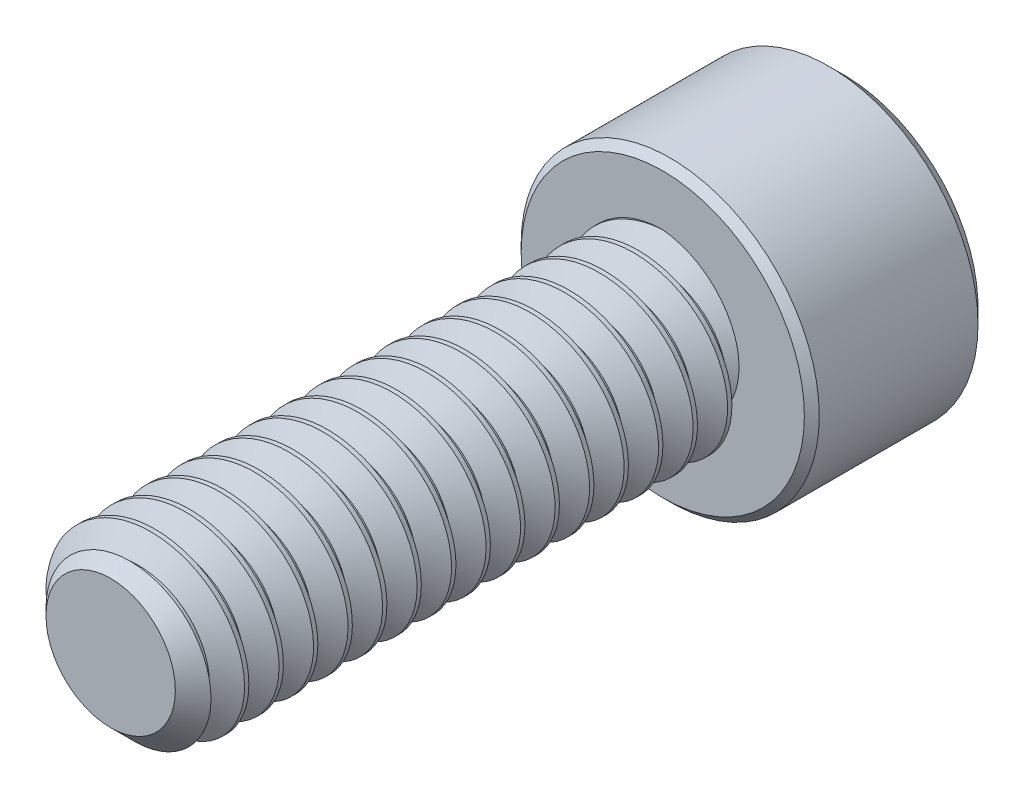
from build123d import *

# Parameters (mm, degrees)
SKETCH1_R          = 2.0828
EXTRUDE1_DEPTH     = 12.7
CHAMFER3_SIZE      = 0.5953125
CUT_SWEEP1_PITCH   = 0.79375
SKETCH6_R          = 3.429
EXTRUDE2_DEPTH     = 4.1656
CUT_EXTRUDE1_DEPTH = 2.67890625
CHAMFER1_SIZE      = 0.3429
CHAMFER2_SIZE      = 0.17145


with BuildPart() as part:
    # Sketch1 → Extrude1 (new body)
    with BuildSketch(Plane.XY):
        Circle(SKETCH1_R)
    extrude(amount=-EXTRUDE1_DEPTH)

    # Chamfer3
    chamfer3_edges = [part.edges().sort_by_distance(p)[0] for p in [
        (-2.0828, 0, 0),
    ]]
    chamfer(chamfer3_edges, length=CHAMFER3_SIZE)

    # Cut-Sweep1: the profile of Sketch3 profile screwed along a right-hand helix of 17 turns, 6 arcs to a turn; built about Z, then put on its axis
    cut_sweep1_z = Axis((0, 0, 0), (0, 0, 1))
    cut_sweep1_corners = [(2.0831, 0, -0.694704455), (1.567244252, 0, -0.396875), (1.567244252, 0, -0.29765625), (2.0831, 0, 0.000173205)]
    with BuildLine(mode=Mode.PRIVATE) as cut_sweep1_profile:
        Line(cut_sweep1_corners[0], cut_sweep1_corners[1])
        Line(cut_sweep1_corners[1], cut_sweep1_corners[2])
        Line(cut_sweep1_corners[2], cut_sweep1_corners[3])
        Line(cut_sweep1_corners[3], cut_sweep1_corners[0])
    cut_sweep1_cap = Face(cut_sweep1_profile.wire())
    cut_sweep1_turn_angles = [0, 30, 60, 90, 120, 150, 180, 210, 240, 270, 300, 330, 360]
    cut_sweep1_turn_weights = [1, 0.8660254037844387, 1, 0.8660254037844387, 1, 0.8660254037844387, 1, 0.8660254037844387, 1, 0.8660254037844387, 1, 0.8660254037844387, 1]
    cut_sweep1_turn_rails = [Edge.make_bspline([Vector(p[0], p[1], 0).rotate(cut_sweep1_z, cut_sweep1_turn_angles[k]) / cut_sweep1_turn_weights[k] + Vector(0, 0, p[2] + CUT_SWEEP1_PITCH * cut_sweep1_turn_angles[k] / 360) for k in range(13)], [0, 0, 0, 1, 1, 2, 2, 3, 3, 4, 4, 5, 5, 6, 6, 6], 2, cut_sweep1_turn_weights) for p in cut_sweep1_corners]
    cut_sweep1_turn_sides = [Face.make_surface_from_curves(cut_sweep1_turn_rails[p[0]], cut_sweep1_turn_rails[p[1]]) for p in [(0, 1), (1, 2), (2, 3), (3, 0)]]
    cut_sweep1 = Plane(origin=(0, 0, 0), x_dir=(0, 1, 0), z_dir=(0, 0, -1)) * Solid(Shell([*[p.moved(Location((0, 0, CUT_SWEEP1_PITCH * i))) for i in range(17) for p in cut_sweep1_turn_sides], cut_sweep1_cap, cut_sweep1_cap.rotate(cut_sweep1_z, 6120).moved(Location((0, 0, CUT_SWEEP1_PITCH * 6120 / 360)))]))
    add(cut_sweep1, mode=Mode.SUBTRACT)

    # Sketch6 → Extrude2 (add)
    with BuildSketch(Plane(origin=(0, 0, -12.7), x_dir=(-1, 0, 0), z_dir=(0, 0, -1))):
        Circle(SKETCH6_R)
    extrude(amount=EXTRUDE2_DEPTH)

    # Sketch7 → Cut-Extrude1 (cut)
    with BuildSketch(Plane(origin=(0, 0, -16.8656), x_dir=(-1, 0, 0), z_dir=(0, 0, -1))):
        Polygon((0, 2.062222993), (-1.7859375, 1.031111496), (-1.7859375, -1.031111496), (0, -2.062222993), (1.7859375, -1.031111496), (1.7859375, 1.031111496), align=None)
    extrude(amount=-CUT_EXTRUDE1_DEPTH, mode=Mode.SUBTRACT)

    # Cut-Extrude2 cone 1 section (through the dimple's axis) → Cut-Extrude2 (revolve, cut)
    with BuildSketch(Plane(origin=(0, 0, -16.8656), x_dir=(0, 1, 0), z_dir=(1, 0, 0))):
        Polygon((0, 0), (2.062222993, 0), (0, 2.062222993), align=None)
    revolve(axis=Axis((0, 0, -16.8656), (0, 0, 1)), mode=Mode.SUBTRACT)

    # Chamfer1
    chamfer1_edges = [part.edges().sort_by_distance(p)[0] for p in [
        (3.429, 0, -16.8656),
    ]]
    chamfer(chamfer1_edges, length=CHAMFER1_SIZE)

    # Chamfer2
    chamfer2_edges = [part.edges().sort_by_distance(p)[0] for p in [
        (3.429, 0, -12.7),
    ]]
    chamfer(chamfer2_edges, length=CHAMFER2_SIZE)


solid = part.part
